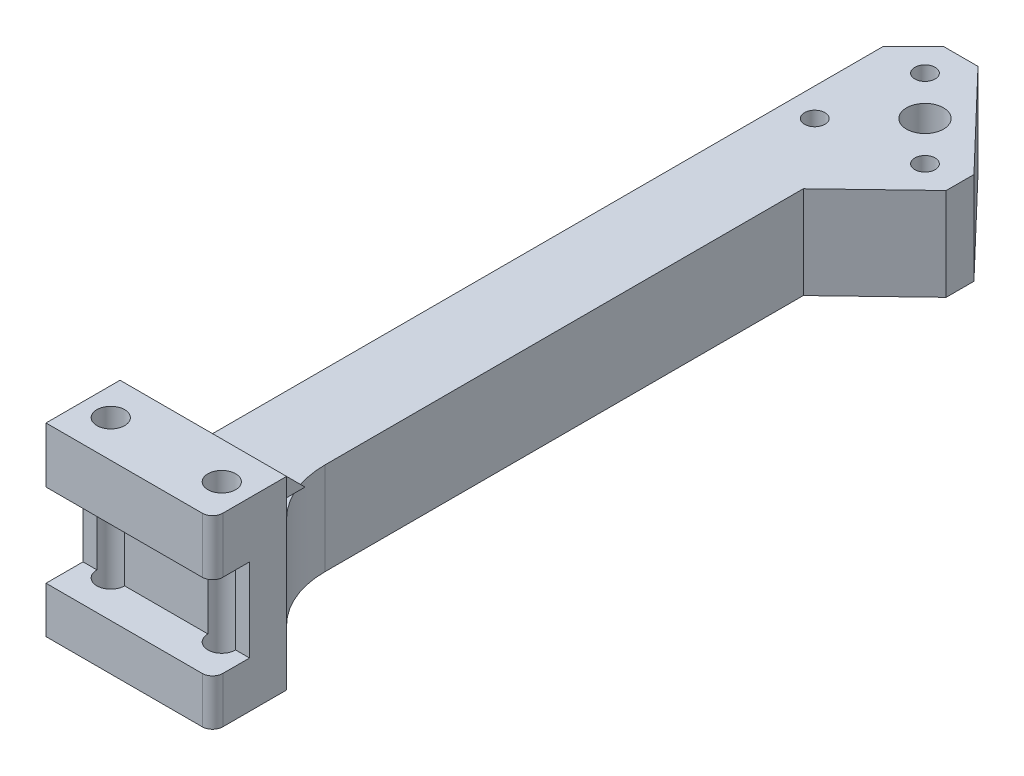
from build123d import *

# Parameters (mm, degrees)
SKETCH1_R           = 1.5
SKETCH1_R_2         = 1.1
SKETCH1_R_3         = 2
BOSS_EXTRUDE1_DEPTH = 10
SKETCH4_R           = 1.5
BOSS_EXTRUDE2_DEPTH = 10
SKETCH5_W           = 4
SKETCH5_H           = 9
CUT_EXTRUDE1_DEPTH  = 98.527855934
BOSS_EXTRUDE3_DEPTH = 10


with BuildPart() as part:
    # Sketch1 → Boss-Extrude1 (new body)
    with BuildSketch(Plane(origin=(0, 0, 0), x_dir=(1, 0, 0), z_dir=(0, 1, 0))):
        with BuildLine():
            Line((0, 90.435028843), (0, 0))
            Line((0, 0), (16.888562252, 0))
            ThreePointArc((16.888562252, 0), (17.67446742, 0.32553258), (18, 1.111437748))
            Line((18, 1.111437748), (18, 8))
            Line((18, 8), (11.928932188, 14.071067812))
            ThreePointArc((11.928932188, 14.071067812), (9.761204675, 17.3153013), (9, 21.142135624))
            Line((9, 21.142135624), (9, 72.848718952))
            Line((9, 72.848718952), (16.888562252, 80.402733417))
            Line((16.888562252, 80.402733417), (16.888562252, 83.402733417))
            Line((16.888562252, 83.402733417), (6.987162403, 93.742640687))
            Line((6.987162403, 93.742640687), (3.307611845, 93.742640687))
            Line((3.307611845, 93.742640687), (0, 90.435028843))
        make_face()
        with Locations((3, 4)):
            Circle(SKETCH1_R, mode=Mode.SUBTRACT)
        with Locations((15, 4)):
            Circle(SKETCH1_R, mode=Mode.SUBTRACT)
        with Locations((13.242640687, 81.757359313)):
            Circle(SKETCH1_R_2, mode=Mode.SUBTRACT)
        with Locations((3.041545779, 80.041545779)):
            Circle(SKETCH1_R_2, mode=Mode.SUBTRACT)
        with Locations((4.757359313, 90.242640687)):
            Circle(SKETCH1_R_2, mode=Mode.SUBTRACT)
        with Locations((9, 86)):
            Circle(SKETCH1_R_3, mode=Mode.SUBTRACT)
    extrude(amount=BOSS_EXTRUDE1_DEPTH)

    # Sketch4 → Boss-Extrude2 (add)
    with BuildSketch(Plane(origin=(0, 10, 0), x_dir=(1, 0, 0), z_dir=(0, 1, 0))):
        with BuildLine():
            Line((18, 1.111437748), (18, 8))
            Line((18, 8), (0, 8))
            Line((0, 8), (0, 0))
            Line((0, 0), (16.888562252, 0))
            ThreePointArc((16.888562252, 0), (17.67446742, 0.32553258), (18, 1.111437748))
        make_face()
        with Locations((3, 4)):
            Circle(SKETCH4_R, mode=Mode.SUBTRACT)
        with Locations((15, 4)):
            Circle(SKETCH4_R, mode=Mode.SUBTRACT)
    extrude(amount=BOSS_EXTRUDE2_DEPTH)

    # Sketch5 → Cut-Extrude1 (cut, through all)
    with BuildSketch(Plane.ZY):
        with Locations((-2, 9.5)):
            Rectangle(SKETCH5_W, SKETCH5_H)
    extrude(amount=-CUT_EXTRUDE1_DEPTH, mode=Mode.SUBTRACT)

    # Sketch6 → Boss-Extrude3 (add)
    with BuildSketch(Plane.ZY):
        Polygon((-8, 20), (-18, 10), (-8, 10), align=None)
    extrude(amount=-BOSS_EXTRUDE3_DEPTH)


solid = part.part
